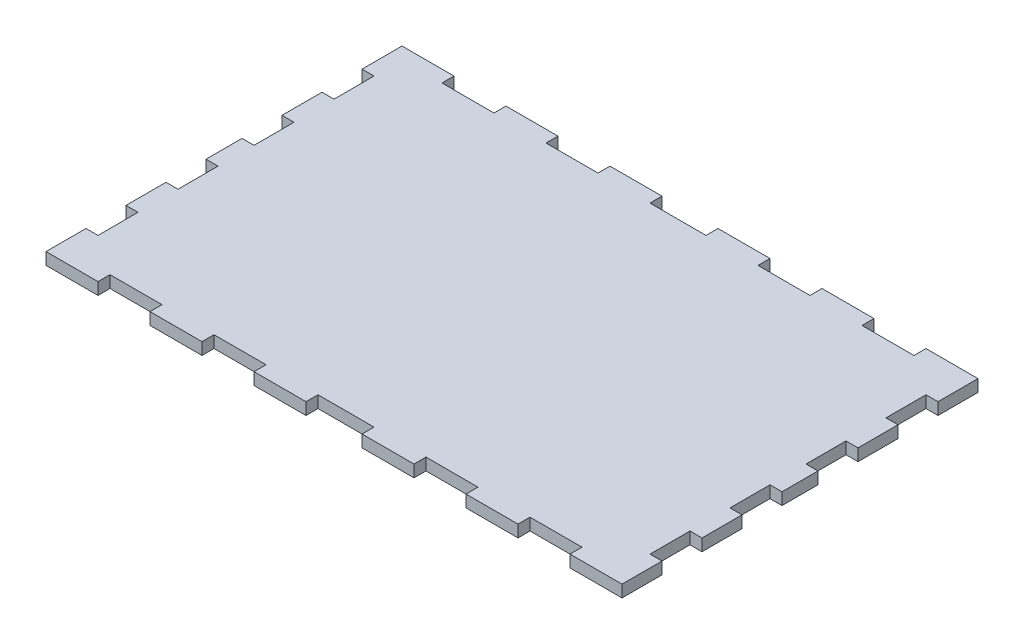
from build123d import *

# Parameters (mm, degrees)
BOSS_EXTRUDE1_DEPTH = 3


with BuildPart() as part:
    # Sketch1 → Boss-Extrude1 (new body)
    with BuildSketch(Plane(origin=(0, 0, 0), x_dir=(1, 0, 0), z_dir=(0, 1, 0))):
        Polygon((26, 89), (39, 89), (39, 86), (52, 86), (52, 89), (65, 89), (65, 86), (79, 86), (79, 89), (92, 89), (92, 86), (105, 86), (105, 89), (118, 89), (118, 86), (131, 86), (131, 89), (144, 89), (144, 79), (141, 79), (141, 69), (144, 69), (144, 59), (141, 59), (141, 49), (144, 49), (144, 40), (141, 40), (141, 30), (144, 30), (144, 20), (141, 20), (141, 10), (144, 10), (144, 0), (131, 0), (131, 3), (118, 3), (118, 0), (105, 0), (105, 3), (92, 3), (92, 0), (79, 0), (79, 3), (65, 3), (65, 0), (52, 0), (52, 3), (39, 3), (39, 0), (26, 0), (26, 3), (13, 3), (13, 0), (0, 0), (0, 10), (3, 10), (3, 20), (0, 20), (0, 30), (3, 30), (3, 40), (0, 40), (0, 49), (3, 49), (3, 59), (0, 59), (0, 69), (3, 69), (3, 79), (0, 79), (0, 89), (13, 89), (13, 86), (26, 86), align=None)
    extrude(amount=BOSS_EXTRUDE1_DEPTH)


solid = part.part
